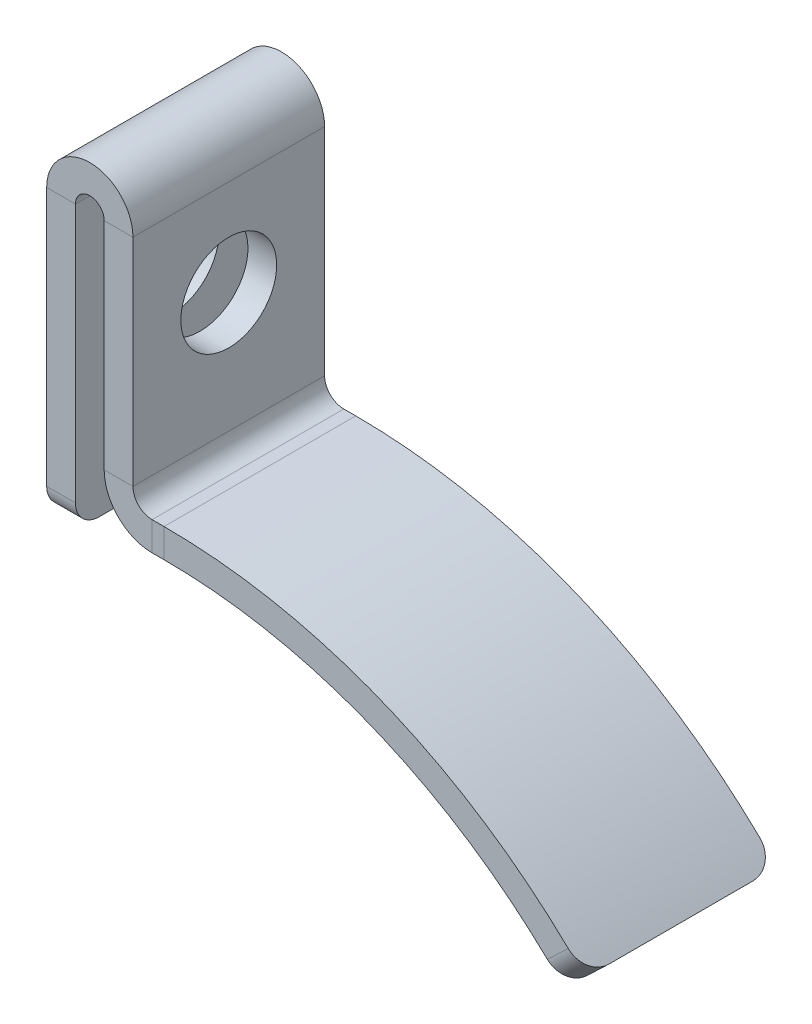
from build123d import *

# Parameters (mm, degrees)
BASE_FLANGE3_DEPTH      = 4
FILLET3_R               = 1
CUT_EXTRUDE2_DEPTH      = 41.856527321
CUT_EXTRUDE2_DEPTH_BACK = 41.856527321
SKETCH9_R               = 2
ECHELLE2_SCALE          = 0.212765957


# Sheet-metal steps are written as plain solids
with BuildPart() as part:
    # Sketch7 → Base-Flange3 (new, symmetric)
    with BuildSketch(Plane.XY):
        with BuildLine():
            Line((-3.7, 23.065125189), (-3.7, 34.866642891))
            ThreePointArc((-3.7, 34.866642891), (-3.1, 35.466642891), (-2.5, 34.866642891))
            Line((-2.5, 34.866642891), (-2.5, 25.858610285))
            ThreePointArc((-2.5, 25.858610285), (-1.914213562, 24.444396722), (-0.5, 23.858610285))
            Line((-0.5, 23.858610285), (0, 23.858610285))
            ThreePointArc((0, 23.858610285), (9.086009171, 21.994836321), (16.704533318, 16.704533318))
            Line((16.704533318, 16.704533318), (17.573079397, 17.532559712))
            ThreePointArc((17.573079397, 17.532559712), (9.558432883, 23.097930078), (0, 25.058610285))
            Line((0, 25.058610285), (-0.5, 25.058610285))
            ThreePointArc((-0.5, 25.058610285), (-1.065685425, 25.29292486), (-1.3, 25.858610285))
            Line((-1.3, 25.858610285), (-1.3, 34.866642891))
            ThreePointArc((-1.3, 34.866642891), (-3.1, 36.666642891), (-4.9, 34.866642891))
            Line((-4.9, 34.866642891), (-4.9, 23.065125189))
            Line((-4.9, 23.065125189), (-3.7, 23.065125189))
        make_face()
    extrude(amount=BASE_FLANGE3_DEPTH, both=True)

    # Fillet3
    fillet3_edges = [part.edges().sort_by_distance(p)[0] for p in [
        (17.138806358, 17.118546515, -4),
        (-4.3, 23.065125189, -4),
        (17.138806358, 17.118546515, 4),
        (-4.3, 23.065125189, 4),
    ]]
    fillet(fillet3_edges, radius=FILLET3_R)

    # Sketch9 → Cut-Extrude2 (cut, two sides: drawn at the far end of the back side and taken through both)
    with BuildSketch(Plane(origin=(0, 0, 0), x_dir=(0, 0, -1), z_dir=(1, 0, 0)).offset(-CUT_EXTRUDE2_DEPTH_BACK)):
        with Locations(Location((0, 30.866642891, 0), (0, 0, 270))):
            Circle(SKETCH9_R)
    extrude(amount=CUT_EXTRUDE2_DEPTH + CUT_EXTRUDE2_DEPTH_BACK, mode=Mode.SUBTRACT)


with BuildPart() as part_1:
    # Echelle2: scaled about (2.31636153, 26.36174226, 0)
    add(part.part.scale(ECHELLE2_SCALE).moved(Location((1.823518651, 20.752860928, 0))))


solid = part_1.part
